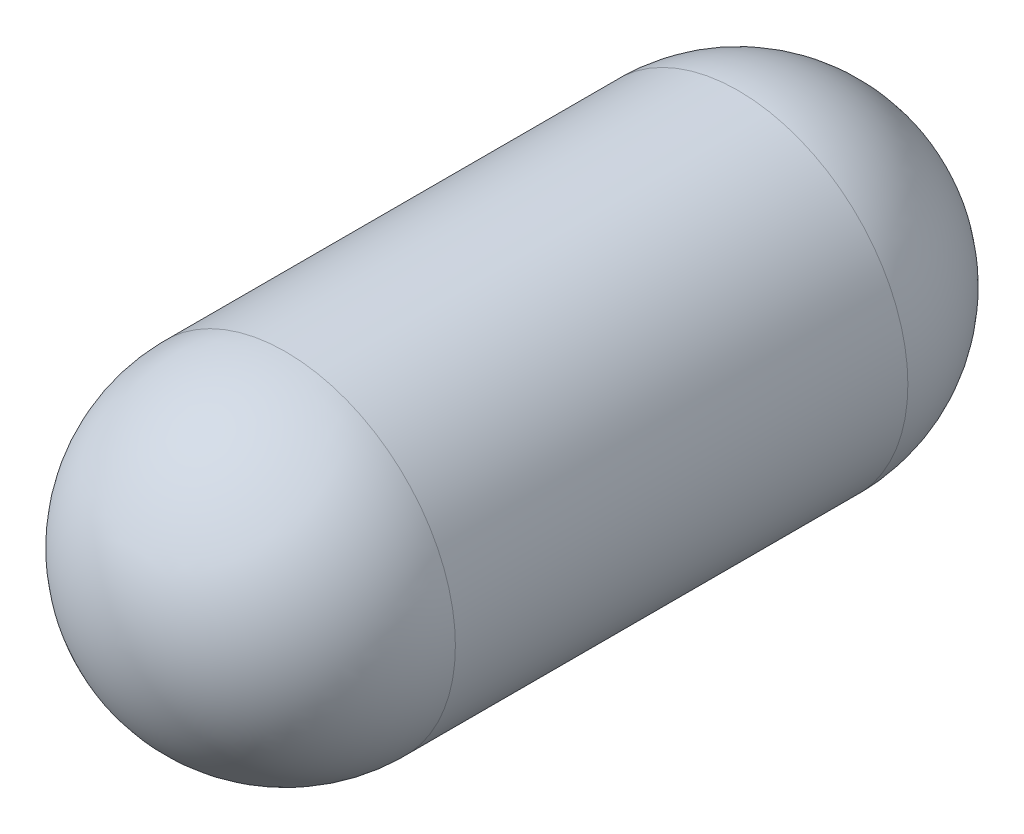
from build123d import *
from build123d.topology import SkipClean

# Parameters (mm, degrees)
SKETCH1_R           = 9.525
BOSS_EXTRUDE1_DEPTH = 25.4


with BuildPart() as part:
    # Sketch1 → Boss-Extrude1 (new body)
    with BuildSketch(Plane.XY):
        Circle(SKETCH1_R)
    extrude(amount=BOSS_EXTRUDE1_DEPTH)

    # Sketch2 → Revolve1 (revolve)
    with BuildSketch(Plane(origin=(0, 0, 0), x_dir=(0, 0, -1), z_dir=(1, 0, 0))):
        with BuildLine():
            Line((0, 9.525), (0, -9.525))
            ThreePointArc((0, -9.525), (9.525, 0), (0, 9.525))
        make_face()
    revolve(axis=Axis((0, 9.525, 0), (0, -1, 0)))

    # Sketch3 → Revolve2 (revolve)
    with SkipClean():  # the faces are left unmerged after this step: merging them gives an invalid solid
        with BuildSketch(Plane(origin=(0, 0, 0), x_dir=(0, 0, -1), z_dir=(1, 0, 0))):
            with BuildLine():
                Line((-25.4, 9.525), (-25.4, -9.525))
                ThreePointArc((-25.4, -9.525), (-34.925, 0), (-25.4, 9.525))
            make_face()
        revolve(axis=Axis((0, 9.525, 25.4), (0, -1, 0)))


solid = part.part
